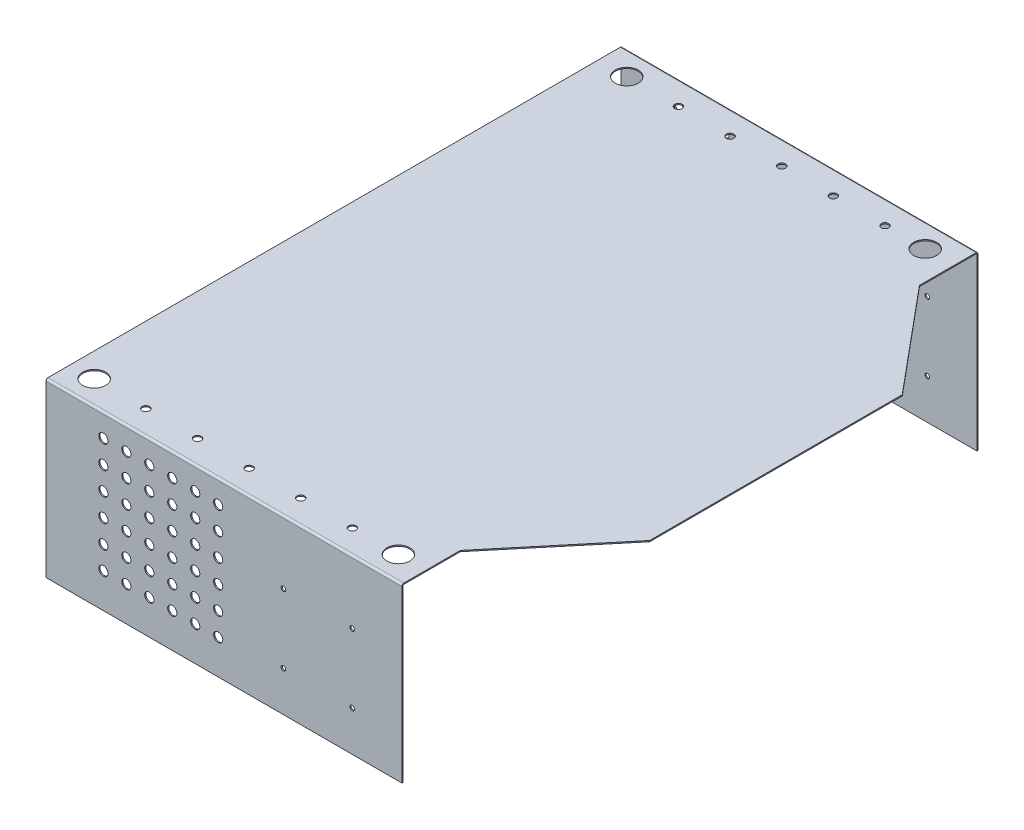
from build123d import *

# Parameters (mm, degrees)
SKETCH6_R                    = 10
SKETCH6_R_2                  = 3.25
BASE_FLANGE2_DEPTH           = 1
EDGE_FLANGE1_STRIP_W         = 5.4732
EDGE_FLANGE1_STRIP_H         = 1
EDGE_FLANGE1_STRIP_CUT_DEPTH = 310
EDGE_FLANGE1_DEPTH           = 310
SKETCH23_R                   = 4
CUT_EXTRUDE1_DEPTH           = 10
SKETCH24_R                   = 2
CUT_EXTRUDE2_DEPTH           = 10


# Sheet-metal steps are written as plain solids
with BuildPart() as part:
    # Sketch6 → Base-Flange2 (new body)
    with BuildSketch(Plane(origin=(0, 0, 0), x_dir=(1, 0, 0), z_dir=(0, 1, 0))):
        Polygon((-188.372816417, 230.260729543), (-188.372816417, -269.739270457), (121.627183583, -269.739270457), (121.627183583, -219.739270457), (196.627183583, -129.739270457), (196.627183583, 90.260729543), (121.627183583, 180.260729543), (121.627183583, 230.260729543), align=None)
        with Locations(Location((-163.372816417, 210.260729543, 0), (0, 0, 270))):
            Circle(SKETCH6_R, mode=Mode.SUBTRACT)
        with Locations(Location((-118.372816417, 210.260729543, 0), (0, 0, 270))):
            Circle(SKETCH6_R_2, mode=Mode.SUBTRACT)
        with Locations(Location((-73.372816417, 210.260729543, 0), (0, 0, 270))):
            Circle(SKETCH6_R_2, mode=Mode.SUBTRACT)
        with Locations(Location((-28.372816417, 210.260729543, 0), (0, 0, 270))):
            Circle(SKETCH6_R_2, mode=Mode.SUBTRACT)
        with Locations(Location((16.627183583, 210.260729543, 0), (0, 0, 270))):
            Circle(SKETCH6_R_2, mode=Mode.SUBTRACT)
        with Locations(Location((96.627183583, 210.260729543, 0), (0, 0, 270))):
            Circle(SKETCH6_R, mode=Mode.SUBTRACT)
        with Locations(Location((61.627183583, 210.260729543, 0), (0, 0, 270))):
            Circle(SKETCH6_R_2, mode=Mode.SUBTRACT)
        with Locations(Location((-167.356668965, -249.739270457, 0), (0, 0, 90))):
            Circle(SKETCH6_R, mode=Mode.SUBTRACT)
        with Locations(Location((-122.356668965, -249.739270457, 0), (0, 0, 90))):
            Circle(SKETCH6_R_2, mode=Mode.SUBTRACT)
        with Locations(Location((-77.356668965, -249.739270457, 0), (0, 0, 90))):
            Circle(SKETCH6_R_2, mode=Mode.SUBTRACT)
        with Locations(Location((-32.356668965, -249.739270457, 0), (0, 0, 90))):
            Circle(SKETCH6_R_2, mode=Mode.SUBTRACT)
        with Locations(Location((12.643331035, -249.739270457, 0), (0, 0, 90))):
            Circle(SKETCH6_R_2, mode=Mode.SUBTRACT)
        with Locations(Location((97.643331035, -249.739270457, 0), (0, 0, 90))):
            Circle(SKETCH6_R, mode=Mode.SUBTRACT)
        with Locations(Location((57.643331035, -249.739270457, 0), (0, 0, 90))):
            Circle(SKETCH6_R_2, mode=Mode.SUBTRACT)
    extrude(amount=-BASE_FLANGE2_DEPTH)

    # Edge-Flange1 strip (across the edge) → Edge-Flange1 strip cut (cut)
    with BuildSketch(Plane(origin=(121.627183583, -1, 269.739270457), x_dir=(0, 0, -1), z_dir=(-1, 0, 0))):
        with Locations((-2, -0.5)):
            Rectangle(EDGE_FLANGE1_STRIP_W, EDGE_FLANGE1_STRIP_H)
    edge_flange1_strip_cut = extrude(amount=EDGE_FLANGE1_STRIP_CUT_DEPTH, mode=Mode.SUBTRACT)

    # Edge-Flange1 section (across the edge) → Edge-Flange1 (add)
    with BuildSketch(Plane(origin=(121.627183583, -1, 269.739270457), x_dir=(0, 0, -1), z_dir=(-1, 0, 0))):
        with BuildLine():
            Line((-1, 0.7366), (-1, 149))
            Line((-1, 149), (0, 149))
            Line((0, 149), (0, 0.7366))
            ThreePointArc((0, 0.7366), (0.215745145, 0.215745145), (0.7366, 0))
            Line((0.7366, 0), (0.7366, -1))
            ThreePointArc((0.7366, -1), (-0.491361636, -0.491361636), (-1, 0.7366))
        make_face()
    edge_flange1 = extrude(amount=EDGE_FLANGE1_DEPTH)

    # Sketch23 → Cut-Extrude1 (cut)
    with BuildSketch(Plane.XY.offset(270.739270457)):
        with Locations((-138.372816417, -120)):
            Circle(SKETCH23_R)
        with Locations((-118.372816417, -120)):
            Circle(SKETCH23_R)
        with Locations((-98.372816417, -120)):
            Circle(SKETCH23_R)
        with Locations((-78.372816417, -120)):
            Circle(SKETCH23_R)
        with Locations((-58.372816417, -120)):
            Circle(SKETCH23_R)
        with Locations((-38.372816417, -120)):
            Circle(SKETCH23_R)
        with Locations((-118.372816417, -100)):
            Circle(SKETCH23_R)
        with Locations((-98.372816417, -100)):
            Circle(SKETCH23_R)
        with Locations((-78.372816417, -100)):
            Circle(SKETCH23_R)
        with Locations((-58.372816417, -100)):
            Circle(SKETCH23_R)
        with Locations((-38.372816417, -100)):
            Circle(SKETCH23_R)
        with Locations((-118.372816417, -80)):
            Circle(SKETCH23_R)
        with Locations((-98.372816417, -80)):
            Circle(SKETCH23_R)
        with Locations((-78.372816417, -80)):
            Circle(SKETCH23_R)
        with Locations((-58.372816417, -80)):
            Circle(SKETCH23_R)
        with Locations((-38.372816417, -80)):
            Circle(SKETCH23_R)
        with Locations((-118.372816417, -60)):
            Circle(SKETCH23_R)
        with Locations((-98.372816417, -60)):
            Circle(SKETCH23_R)
        with Locations((-78.372816417, -60)):
            Circle(SKETCH23_R)
        with Locations((-58.372816417, -60)):
            Circle(SKETCH23_R)
        with Locations((-38.372816417, -60)):
            Circle(SKETCH23_R)
        with Locations((-118.372816417, -40)):
            Circle(SKETCH23_R)
        with Locations((-98.372816417, -40)):
            Circle(SKETCH23_R)
        with Locations((-78.372816417, -40)):
            Circle(SKETCH23_R)
        with Locations((-58.372816417, -40)):
            Circle(SKETCH23_R)
        with Locations((-38.372816417, -40)):
            Circle(SKETCH23_R)
        with Locations((-118.372816417, -20)):
            Circle(SKETCH23_R)
        with Locations((-98.372816417, -20)):
            Circle(SKETCH23_R)
        with Locations((-78.372816417, -20)):
            Circle(SKETCH23_R)
        with Locations((-58.372816417, -20)):
            Circle(SKETCH23_R)
        with Locations((-38.372816417, -20)):
            Circle(SKETCH23_R)
        with Locations((-138.372816417, -100)):
            Circle(SKETCH23_R)
        with Locations((-138.372816417, -80)):
            Circle(SKETCH23_R)
        with Locations((-138.372816417, -60)):
            Circle(SKETCH23_R)
        with Locations((-138.372816417, -40)):
            Circle(SKETCH23_R)
        with Locations((-138.372816417, -20)):
            Circle(SKETCH23_R)
    cut_extrude1 = extrude(amount=-CUT_EXTRUDE1_DEPTH, mode=Mode.SUBTRACT)

    # Sketch24 → Cut-Extrude2 (cut)
    with BuildSketch(Plane.XY.offset(270.739270457)):
        with Locations((18.484920525, -55)):
            Circle(SKETCH24_R)
        with Locations(Location((78.484920525, -55, 0), (0, 0, 90))):
            Circle(SKETCH24_R)
        with Locations((78.484920525, -115)):
            Circle(SKETCH24_R)
        with Locations(Location((18.484920525, -115, 0), (0, 0, 90))):
            Circle(SKETCH24_R)
    cut_extrude2 = extrude(amount=-CUT_EXTRUDE2_DEPTH, mode=Mode.SUBTRACT)

    # Mirror2: Edge-Flange1 strip cut, Edge-Flange1, Cut-Extrude1 across plane
    add(edge_flange1_strip_cut.mirror(Plane(origin=(0, 0, 19.739270457), x_dir=(1, 0, 0), z_dir=(0, 0, -1))), mode=Mode.SUBTRACT)
    add(edge_flange1.mirror(Plane(origin=(0, 0, 19.739270457), x_dir=(1, 0, 0), z_dir=(0, 0, -1))))
    add(cut_extrude1.mirror(Plane(origin=(0, 0, 19.739270457), x_dir=(1, 0, 0), z_dir=(0, 0, -1))), mode=Mode.SUBTRACT)

    # Mirror3: Cut-Extrude2 across plane
    add(cut_extrude2.mirror(Plane(origin=(0, 0, 19.739270457), x_dir=(1, 0, 0), z_dir=(0, 0, -1))), mode=Mode.SUBTRACT)


solid = part.part
